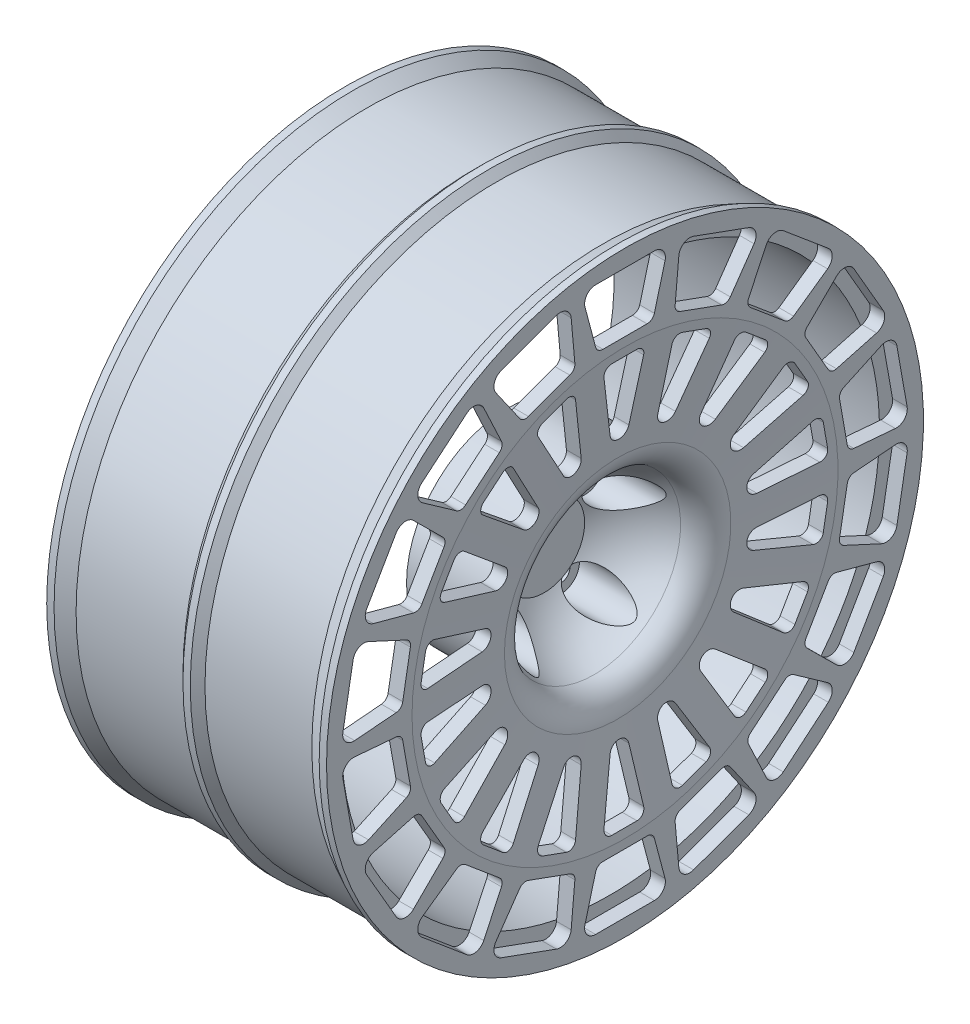
from build123d import *
from OCP.BRepAlgoAPI import BRepAlgoAPI_Cut
from OCP.TopTools import TopTools_ListOfShape

# Parameters (mm, degrees)
CUT_EXTRUDE1_DEPTH       = 345.776347797
CUT_EXTRUDE1_DEPTH_BACK  = 9.973014
CUT_EXTRUDE2_REACH       = 346.776
BOSS_EXTRUDE1_REACH      = 341.368
BOSS_EXTRUDE1_END_RADIUS = 60.077568815
SKETCH9_R                = 27.5
SKETCH10_R               = 27.5
CUT_EXTRUDE3_DEPTH       = 45
SKETCH11_R               = 12.5
CUT_EXTRUDE5_DEPTH       = 60
CUT_EXTRUDE6_REACH       = 313.62
SKETCH12_R               = 6


with BuildPart() as part:
    # Sketch1 → Revolve1 (revolve)
    with BuildSketch(Plane.XY, mode=Mode.PRIVATE) as revolve1_sk:
        with BuildLine():
            Line((-7.5, 198.2), (-80.25, 198.2))
            Line((-80.25, 198.2), (-90.25, 203.2))
            Line((-90.25, 203.2), (-95.25, 203.2))
            Line((-95.25, 203.2), (-95.25, 183.2))
            Line((-95.25, 183.2), (85.276985641, 183.2))
            Line((85.276985641, 183.2), (85.276985641, 145.734155709))
            Line((85.276985641, 145.734155709), (80.276985641, 77.812499305))
            ThreePointArc((80.276985641, 77.812499305), (77.794183907, 71.921195418), (72.25, 68.73783387))
            Line((72.25, 68.73783387), (15.25, 68.73783387))
            Line((15.25, 68.73783387), (15.25, 0))
            Line((15.25, 0), (25.809727319, 0))
            ThreePointArc((25.809727319, 0), (39.456179426, 38.124344925), (74.196028717, 58.929012726))
            ThreePointArc((74.196028717, 58.929012726), (85.284396531, 65.295735823), (90.25, 77.078343596))
            Line((90.25, 77.078343596), (95.25, 145))
            Line((95.25, 145), (95.25, 183.2))
            Line((95.25, 183.2), (95.25, 203.2))
            Line((95.25, 203.2), (90.25, 203.2))
            Line((90.25, 203.2), (80.25, 198.2))
            Line((80.25, 198.2), (7.5, 198.2))
            Line((7.5, 198.2), (2.5, 203.2))
            Line((2.5, 203.2), (-2.5, 203.2))
            Line((-2.5, 203.2), (-7.5, 198.2))
        make_face()
    revolve(revolve1_sk.sketch.rotate(Axis((-95.25, 0, 0), (1, 0, 0)), 90), axis=Axis((-95.25, 0, 0), (1, 0, 0)))


with BuildPart() as cut_extrude1_tool:
    # Sketch2 → Cut-Extrude1 (new, two sides: drawn at the far end of the back side and taken through both)
    with BuildSketch(Plane(origin=(95.25, 0, 0), x_dir=(0, 0, -1), z_dir=(1, 0, 0)).offset(-CUT_EXTRUDE1_DEPTH_BACK)):
        with BuildLine():
            Line((84.289757984, 173.108118749), (46.702053153, 186.788924482))
            ThreePointArc((46.702053153, 186.788924482), (40.115923143, 186.072243048), (36.667281918, 180.415599654))
            Line((36.667281918, 180.415599654), (34.122310629, 152.226365678))
            ThreePointArc((34.122310629, 152.226365678), (34.926689668, 149.026094193), (37.54965233, 147.023887889))
            Line((37.54965233, 147.023887889), (65.740430954, 136.763283589))
            ThreePointArc((65.740430954, 136.763283589), (69.036730331, 136.611054702), (71.710015282, 138.54556001))
            Line((71.710015282, 138.54556001), (87.880144494, 161.775642064))
            ThreePointArc((87.880144494, 161.775642064), (88.874352333, 168.325626153), (84.289757984, 173.108118749))
        make_face()
        with BuildLine():
            Line((8.579866528, 139), (-8.579866528, 139))
            ThreePointArc((-8.579866528, 139), (-12.417217448, 137.205423204), (-13.5, 133.109895167))
            Line((-13.5, 133.109895167), (-6.396173514, 93.842863717))
            ThreePointArc((-6.396173514, 93.842863717), (0, 88.5), (6.396173514, 93.842863717))
            Line((6.396173514, 93.842863717), (13.5, 133.109895167))
            ThreePointArc((13.5, 133.109895167), (12.417217448, 137.205423204), (8.579866528, 139))
        make_face()
        with BuildLine():
            Line((20, 191.497216894), (-20, 191.497216894))
            ThreePointArc((-20, 191.497216894), (-25.943818283, 188.571167508), (-27.249795009, 182.076156686))
            Line((-27.249795009, 182.076156686), (-19.999999905, 154.716510089))
            ThreePointArc((-19.999999905, 154.716510089), (-18.149573546, 151.984352424), (-15, 151))
            Line((-15, 151), (15, 151))
            ThreePointArc((15, 151), (18.149573546, 151.984352424), (19.999999905, 154.716510089))
            Line((19.999999905, 154.716510089), (27.249795009, 182.076156686))
            ThreePointArc((27.249795009, 182.076156686), (25.943818283, 188.571167508), (20, 191.497216894))
        make_face()
        with BuildLine():
            Line((32.840415042, 129.699658177), (26.085712646, 90.37106673))
            ThreePointArc((26.085712646, 90.37106673), (30.268782684, 83.16279694), (38.106586751, 85.995826366))
            Line((38.106586751, 85.995826366), (58.212115804, 120.465114307))
            ThreePointArc((58.212115804, 120.465114307), (58.595386115, 124.683985226), (55.603237186, 127.68278711))
            Line((55.603237186, 127.68278711), (39.478362659, 133.551761469))
            ThreePointArc((39.478362659, 133.551761469), (35.258650903, 133.177862208), (32.840415042, 129.699658177))
        make_face()
        with BuildLine():
            Line((138.412927171, 133.83962668), (107.771149446, 159.551131068))
            ThreePointArc((107.771149446, 159.551131068), (101.337092189, 161.130259942), (96.161743494, 156.994258653))
            Line((96.161743494, 156.994258653), (84.128966909, 131.375474945))
            ThreePointArc((84.128966909, 131.375474945), (83.790278644, 128.093089612), (85.570262416, 125.314525056))
            Line((85.570262416, 125.314525056), (108.551595709, 106.030896766))
            ThreePointArc((108.551595709, 106.030896766), (111.597038564, 104.760447619), (114.770744489, 105.66397068))
            Line((114.770744489, 105.66397068), (137.91085158, 121.962597455))
            ThreePointArc((137.91085158, 121.962597455), (141.085327847, 127.777530062), (138.412927171, 133.83962668))
        make_face()
        with BuildLine():
            Line((75.219791358, 110.645728248), (55.421276877, 75.999185361))
            ThreePointArc((55.421276877, 75.999185361), (56.886703457, 67.794933216), (65.220783232, 67.776423193))
            Line((65.220783232, 67.776423193), (95.902991322, 93.290462786))
            ThreePointArc((95.902991322, 93.290462786), (97.706086442, 97.123818489), (95.920036823, 100.965145697))
            Line((95.920036823, 100.965145697), (82.77491867, 111.99520949))
            ThreePointArc((82.77491867, 111.99520949), (78.681805593, 113.087085533), (75.219791358, 110.645728248))
        make_face()
        with BuildLine():
            Line((175.841454584, 78.428100371), (155.841454584, 113.069116523))
            ThreePointArc((155.841454584, 113.069116523), (150.335512342, 116.753589458), (144.057679609, 114.637093069))
            Line((144.057679609, 114.637093069), (123.988428169, 94.678763038))
            ThreePointArc((123.988428169, 94.678763038), (122.547523404, 91.710167971), (123.269835971, 88.490381057))
            Line((123.269835971, 88.490381057), (138.269835971, 62.509618943))
            ThreePointArc((138.269835971, 62.509618943), (140.69709695, 60.274184453), (143.988428074, 60.037747051))
            Line((143.988428074, 60.037747051), (171.307474618, 67.439063617))
            ThreePointArc((171.307474618, 67.439063617), (176.279330625, 71.81757805), (175.841454584, 78.428100371))
        make_face()
        with BuildLine():
            Line((108.52655071, 78.246290535), (78.072217186, 52.460680609))
            ThreePointArc((78.072217186, 52.460680609), (76.643248235, 44.25), (84.4683907, 41.382183108))
            Line((84.4683907, 41.382183108), (122.02655071, 54.863604632))
            ThreePointArc((122.02655071, 54.863604632), (125.031990756, 57.849085848), (124.66746439, 62.069617626))
            Line((124.66746439, 62.069617626), (116.087597862, 76.930382374))
            ThreePointArc((116.087597862, 76.930382374), (112.614773308, 79.356337356), (108.52655071, 78.246290535))
        make_face()
        with BuildLine():
            Line((192.06090743, 13.556987682), (185.114980324, 52.949297802))
            ThreePointArc((185.114980324, 52.949297802), (181.20125099, 58.294712986), (174.578133498, 58.453002199))
            Line((174.578133498, 58.453002199), (148.893055117, 46.562394999))
            ThreePointArc((148.893055117, 46.562394999), (146.523728232, 44.265646574), (146.10124804, 40.992991123))
            Line((146.10124804, 40.992991123), (151.31069337, 11.448758533))
            ThreePointArc((151.31069337, 11.448758533), (152.827008975, 8.51796509), (155.838982191, 7.170085065))
            Line((155.838982191, 7.170085065), (184.041887988, 4.781383412))
            ThreePointArc((184.041887988, 4.781383412), (190.211444523, 7.195366211), (192.06090743, 13.556987682))
        make_face()
        with BuildLine():
            Line((128.743406365, 36.409195391), (91.306495879, 22.594643538))
            ThreePointArc((91.306495879, 22.594643538), (87.155486142, 15.367863724), (93.527863628, 9.996641005))
            Line((93.527863628, 9.996641005), (133.431907162, 9.81938606))
            ThreePointArc((133.431907162, 9.81938606), (137.277191708, 11.596899692), (138.378155856, 15.68757762))
            Line((138.378155856, 15.68757762), (135.398399482, 32.586615772))
            ThreePointArc((135.398399482, 32.586615772), (132.964737345, 36.054043719), (128.743406365, 36.409195391))
        make_face()
        with BuildLine():
            Line((185.114980324, -52.949297802), (192.06090743, -13.556987682))
            ThreePointArc((192.06090743, -13.556987682), (190.211444523, -7.195366211), (184.041887988, -4.781383412))
            Line((184.041887988, -4.781383412), (155.838982191, -7.170085065))
            ThreePointArc((155.838982191, -7.170085065), (152.827008975, -8.51796509), (151.31069337, -11.448758532))
            Line((151.31069337, -11.448758532), (146.10124804, -40.992991123))
            ThreePointArc((146.10124804, -40.992991123), (146.523728232, -44.265646574), (148.893055118, -46.562394998))
            Line((148.893055118, -46.562394998), (174.578133498, -58.453002198))
            ThreePointArc((174.578133498, -58.453002198), (181.20125099, -58.294712986), (185.114980324, -52.949297802))
        make_face()
        with BuildLine():
            Line((133.431907162, -9.819386059), (93.527863628, -9.996641005))
            ThreePointArc((93.527863628, -9.996641005), (87.155486142, -15.367863723), (91.306495879, -22.594643538))
            Line((91.306495879, -22.594643538), (128.743406365, -36.409195391))
            ThreePointArc((128.743406365, -36.409195391), (132.964737345, -36.054043719), (135.398399482, -32.586615772))
            Line((135.398399482, -32.586615772), (138.378155856, -15.687577619))
            ThreePointArc((138.378155856, -15.687577619), (137.277191708, -11.596899692), (133.431907162, -9.819386059))
        make_face()
        with BuildLine():
            Line((155.841454584, -113.069116522), (175.841454584, -78.428100371))
            ThreePointArc((175.841454584, -78.428100371), (176.279330625, -71.81757805), (171.307474618, -67.439063617))
            Line((171.307474618, -67.439063617), (143.988428074, -60.037747051))
            ThreePointArc((143.988428074, -60.037747051), (140.69709695, -60.274184453), (138.269835972, -62.509618943))
            Line((138.269835972, -62.509618943), (123.269835972, -88.490381057))
            ThreePointArc((123.269835972, -88.490381057), (122.547523404, -91.710167971), (123.988428169, -94.678763038))
            Line((123.988428169, -94.678763038), (144.057679609, -114.637093069))
            ThreePointArc((144.057679609, -114.637093069), (150.335512342, -116.753589458), (155.841454584, -113.069116522))
        make_face()
        with BuildLine():
            Line((122.02655071, -54.863604632), (84.4683907, -41.382183108))
            ThreePointArc((84.4683907, -41.382183108), (76.643248235, -44.25), (78.072217186, -52.460680609))
            Line((78.072217186, -52.460680609), (108.52655071, -78.246290534))
            ThreePointArc((108.52655071, -78.246290534), (112.614773308, -79.356337356), (116.087597862, -76.930382374))
            Line((116.087597862, -76.930382374), (124.66746439, -62.069617626))
            ThreePointArc((124.66746439, -62.069617626), (125.031990756, -57.849085848), (122.02655071, -54.863604632))
        make_face()
        with BuildLine():
            Line((107.771149446, -159.551131068), (138.412927171, -133.83962668))
            ThreePointArc((138.412927171, -133.83962668), (141.085327847, -127.777530062), (137.91085158, -121.962597455))
            Line((137.91085158, -121.962597455), (114.770744489, -105.663970679))
            ThreePointArc((114.770744489, -105.663970679), (111.597038564, -104.760447619), (108.55159571, -106.030896766))
            Line((108.55159571, -106.030896766), (85.570262416, -125.314525056))
            ThreePointArc((85.570262416, -125.314525056), (83.790278644, -128.093089612), (84.128966909, -131.375474945))
            Line((84.128966909, -131.375474945), (96.161743494, -156.994258652))
            ThreePointArc((96.161743494, -156.994258652), (101.33709219, -161.130259942), (107.771149446, -159.551131068))
        make_face()
        with BuildLine():
            Line((95.902991322, -93.290462786), (65.220783233, -67.776423192))
            ThreePointArc((65.220783233, -67.776423192), (56.886703457, -67.794933216), (55.421276877, -75.999185361))
            Line((55.421276877, -75.999185361), (75.219791358, -110.645728247))
            ThreePointArc((75.219791358, -110.645728247), (78.681805593, -113.087085533), (82.77491867, -111.99520949))
            Line((82.77491867, -111.99520949), (95.920036823, -100.965145697))
            ThreePointArc((95.920036823, -100.965145697), (97.706086442, -97.123818489), (95.902991322, -93.290462786))
        make_face()
        with BuildLine():
            Line((46.702053153, -186.788924482), (84.289757984, -173.108118749))
            ThreePointArc((84.289757984, -173.108118749), (88.874352334, -168.325626153), (87.880144494, -161.775642064))
            Line((87.880144494, -161.775642064), (71.710015282, -138.54556001))
            ThreePointArc((71.710015282, -138.54556001), (69.036730331, -136.611054702), (65.740430954, -136.763283589))
            Line((65.740430954, -136.763283589), (37.54965233, -147.023887889))
            ThreePointArc((37.54965233, -147.023887889), (34.926689668, -149.026094193), (34.122310629, -152.226365678))
            Line((34.122310629, -152.226365678), (36.667281918, -180.415599654))
            ThreePointArc((36.667281918, -180.415599654), (40.115923143, -186.072243048), (46.702053153, -186.788924482))
        make_face()
        with BuildLine():
            Line((58.212115804, -120.465114307), (38.106586751, -85.995826366))
            ThreePointArc((38.106586751, -85.995826366), (30.268782684, -83.16279694), (26.085712646, -90.37106673))
            Line((26.085712646, -90.37106673), (32.840415043, -129.699658177))
            ThreePointArc((32.840415043, -129.699658177), (35.258650903, -133.177862208), (39.478362659, -133.551761469))
            Line((39.478362659, -133.551761469), (55.603237186, -127.68278711))
            ThreePointArc((55.603237186, -127.68278711), (58.595386116, -124.683985226), (58.212115804, -120.465114307))
        make_face()
        with BuildLine():
            Line((-20, -191.497216894), (20, -191.497216894))
            ThreePointArc((20, -191.497216894), (25.943818283, -188.571167508), (27.24979501, -182.076156686))
            Line((27.24979501, -182.076156686), (19.999999905, -154.716510089))
            ThreePointArc((19.999999905, -154.716510089), (18.149573546, -151.984352424), (15, -151))
            Line((15, -151), (-15, -151))
            ThreePointArc((-15, -151), (-18.149573546, -151.984352424), (-19.999999905, -154.716510089))
            Line((-19.999999905, -154.716510089), (-27.249795009, -182.076156686))
            ThreePointArc((-27.249795009, -182.076156686), (-25.943818283, -188.571167508), (-20, -191.497216894))
        make_face()
        with BuildLine():
            Line((13.5, -133.109895167), (6.396173514, -93.842863717))
            ThreePointArc((6.396173514, -93.842863717), (0, -88.5), (-6.396173514, -93.842863717))
            Line((-6.396173514, -93.842863717), (-13.5, -133.109895167))
            ThreePointArc((-13.5, -133.109895167), (-12.417217447, -137.205423204), (-8.579866528, -139))
            Line((-8.579866528, -139), (8.579866528, -139))
            ThreePointArc((8.579866528, -139), (12.417217448, -137.205423204), (13.5, -133.109895167))
        make_face()
        with BuildLine():
            Line((-84.289757984, -173.108118749), (-46.702053153, -186.788924482))
            ThreePointArc((-46.702053153, -186.788924482), (-40.115923143, -186.072243048), (-36.667281918, -180.415599654))
            Line((-36.667281918, -180.415599654), (-34.122310629, -152.226365678))
            ThreePointArc((-34.122310629, -152.226365678), (-34.926689668, -149.026094193), (-37.54965233, -147.023887889))
            Line((-37.54965233, -147.023887889), (-65.740430954, -136.763283589))
            ThreePointArc((-65.740430954, -136.763283589), (-69.036730331, -136.611054702), (-71.710015282, -138.54556001))
            Line((-71.710015282, -138.54556001), (-87.880144494, -161.775642064))
            ThreePointArc((-87.880144494, -161.775642064), (-88.874352333, -168.325626153), (-84.289757984, -173.108118749))
        make_face()
        with BuildLine():
            Line((-32.840415042, -129.699658177), (-26.085712646, -90.37106673))
            ThreePointArc((-26.085712646, -90.37106673), (-30.268782684, -83.16279694), (-38.106586751, -85.995826366))
            Line((-38.106586751, -85.995826366), (-58.212115804, -120.465114307))
            ThreePointArc((-58.212115804, -120.465114307), (-58.595386115, -124.683985226), (-55.603237185, -127.68278711))
            Line((-55.603237185, -127.68278711), (-39.478362659, -133.551761469))
            ThreePointArc((-39.478362659, -133.551761469), (-35.258650903, -133.177862208), (-32.840415042, -129.699658177))
        make_face()
        with BuildLine():
            Line((-138.412927171, -133.83962668), (-107.771149446, -159.551131068))
            ThreePointArc((-107.771149446, -159.551131068), (-101.337092189, -161.130259942), (-96.161743494, -156.994258653))
            Line((-96.161743494, -156.994258653), (-84.128966909, -131.375474945))
            ThreePointArc((-84.128966909, -131.375474945), (-83.790278644, -128.093089612), (-85.570262416, -125.314525056))
            Line((-85.570262416, -125.314525056), (-108.551595709, -106.030896766))
            ThreePointArc((-108.551595709, -106.030896766), (-111.597038564, -104.760447619), (-114.770744488, -105.66397068))
            Line((-114.770744488, -105.66397068), (-137.91085158, -121.962597455))
            ThreePointArc((-137.91085158, -121.962597455), (-141.085327847, -127.777530062), (-138.412927171, -133.83962668))
        make_face()
        with BuildLine():
            Line((-75.219791358, -110.645728248), (-55.421276877, -75.999185361))
            ThreePointArc((-55.421276877, -75.999185361), (-56.886703457, -67.794933216), (-65.220783232, -67.776423193))
            Line((-65.220783232, -67.776423193), (-95.902991322, -93.290462786))
            ThreePointArc((-95.902991322, -93.290462786), (-97.706086442, -97.123818489), (-95.920036823, -100.965145697))
            Line((-95.920036823, -100.965145697), (-82.77491867, -111.99520949))
            ThreePointArc((-82.77491867, -111.99520949), (-78.681805593, -113.087085533), (-75.219791358, -110.645728248))
        make_face()
        with BuildLine():
            Line((-175.841454584, -78.428100371), (-155.841454584, -113.069116523))
            ThreePointArc((-155.841454584, -113.069116523), (-150.335512342, -116.753589458), (-144.057679609, -114.637093069))
            Line((-144.057679609, -114.637093069), (-123.988428169, -94.678763038))
            ThreePointArc((-123.988428169, -94.678763038), (-122.547523404, -91.710167971), (-123.269835971, -88.490381057))
            Line((-123.269835971, -88.490381057), (-138.269835971, -62.509618943))
            ThreePointArc((-138.269835971, -62.509618943), (-140.69709695, -60.274184453), (-143.988428074, -60.037747051))
            Line((-143.988428074, -60.037747051), (-171.307474618, -67.439063617))
            ThreePointArc((-171.307474618, -67.439063617), (-176.279330624, -71.81757805), (-175.841454584, -78.428100371))
        make_face()
        with BuildLine():
            Line((-108.52655071, -78.246290535), (-78.072217186, -52.460680609))
            ThreePointArc((-78.072217186, -52.460680609), (-76.643248235, -44.25), (-84.4683907, -41.382183108))
            Line((-84.4683907, -41.382183108), (-122.02655071, -54.863604632))
            ThreePointArc((-122.02655071, -54.863604632), (-125.031990755, -57.849085848), (-124.66746439, -62.069617626))
            Line((-124.66746439, -62.069617626), (-116.087597862, -76.930382374))
            ThreePointArc((-116.087597862, -76.930382374), (-112.614773308, -79.356337356), (-108.52655071, -78.246290535))
        make_face()
        with BuildLine():
            Line((-192.06090743, -13.556987682), (-185.114980324, -52.949297802))
            ThreePointArc((-185.114980324, -52.949297802), (-181.20125099, -58.294712986), (-174.578133498, -58.453002199))
            Line((-174.578133498, -58.453002199), (-148.893055117, -46.562394999))
            ThreePointArc((-148.893055117, -46.562394999), (-146.523728232, -44.265646574), (-146.10124804, -40.992991123))
            Line((-146.10124804, -40.992991123), (-151.31069337, -11.448758533))
            ThreePointArc((-151.31069337, -11.448758533), (-152.827008975, -8.51796509), (-155.838982191, -7.170085065))
            Line((-155.838982191, -7.170085065), (-184.041887988, -4.781383412))
            ThreePointArc((-184.041887988, -4.781383412), (-190.211444523, -7.195366211), (-192.06090743, -13.556987682))
        make_face()
        with BuildLine():
            Line((-128.743406364, -36.409195391), (-91.306495879, -22.594643538))
            ThreePointArc((-91.306495879, -22.594643538), (-87.155486142, -15.367863724), (-93.527863628, -9.996641005))
            Line((-93.527863628, -9.996641005), (-133.431907161, -9.81938606))
            ThreePointArc((-133.431907161, -9.81938606), (-137.277191708, -11.596899692), (-138.378155856, -15.68757762))
            Line((-138.378155856, -15.68757762), (-135.398399481, -32.586615772))
            ThreePointArc((-135.398399481, -32.586615772), (-132.964737345, -36.054043719), (-128.743406364, -36.409195391))
        make_face()
        with BuildLine():
            Line((-185.114980324, 52.949297802), (-192.06090743, 13.556987682))
            ThreePointArc((-192.06090743, 13.556987682), (-190.211444523, 7.195366211), (-184.041887988, 4.781383412))
            Line((-184.041887988, 4.781383412), (-155.838982191, 7.170085065))
            ThreePointArc((-155.838982191, 7.170085065), (-152.827008975, 8.51796509), (-151.31069337, 11.448758532))
            Line((-151.31069337, 11.448758532), (-146.10124804, 40.992991123))
            ThreePointArc((-146.10124804, 40.992991123), (-146.523728232, 44.265646574), (-148.893055117, 46.562394998))
            Line((-148.893055117, 46.562394998), (-174.578133498, 58.453002198))
            ThreePointArc((-174.578133498, 58.453002198), (-181.20125099, 58.294712986), (-185.114980324, 52.949297802))
        make_face()
        with BuildLine():
            Line((-133.431907161, 9.819386059), (-93.527863628, 9.996641005))
            ThreePointArc((-93.527863628, 9.996641005), (-87.155486142, 15.367863723), (-91.306495879, 22.594643538))
            Line((-91.306495879, 22.594643538), (-128.743406364, 36.409195391))
            ThreePointArc((-128.743406364, 36.409195391), (-132.964737345, 36.054043719), (-135.398399482, 32.586615772))
            Line((-135.398399482, 32.586615772), (-138.378155856, 15.687577619))
            ThreePointArc((-138.378155856, 15.687577619), (-137.277191708, 11.596899692), (-133.431907161, 9.819386059))
        make_face()
        with BuildLine():
            Line((-155.841454584, 113.069116522), (-175.841454584, 78.428100371))
            ThreePointArc((-175.841454584, 78.428100371), (-176.279330624, 71.81757805), (-171.307474618, 67.439063617))
            Line((-171.307474618, 67.439063617), (-143.988428074, 60.037747051))
            ThreePointArc((-143.988428074, 60.037747051), (-140.69709695, 60.274184453), (-138.269835971, 62.509618943))
            Line((-138.269835971, 62.509618943), (-123.269835971, 88.490381057))
            ThreePointArc((-123.269835971, 88.490381057), (-122.547523404, 91.710167971), (-123.988428169, 94.678763038))
            Line((-123.988428169, 94.678763038), (-144.057679609, 114.637093069))
            ThreePointArc((-144.057679609, 114.637093069), (-150.335512342, 116.753589458), (-155.841454584, 113.069116522))
        make_face()
        with BuildLine():
            Line((-122.02655071, 54.863604632), (-84.4683907, 41.382183108))
            ThreePointArc((-84.4683907, 41.382183108), (-76.643248235, 44.25), (-78.072217186, 52.460680609))
            Line((-78.072217186, 52.460680609), (-108.52655071, 78.246290534))
            ThreePointArc((-108.52655071, 78.246290534), (-112.614773308, 79.356337356), (-116.087597862, 76.930382374))
            Line((-116.087597862, 76.930382374), (-124.66746439, 62.069617626))
            ThreePointArc((-124.66746439, 62.069617626), (-125.031990755, 57.849085848), (-122.02655071, 54.863604632))
        make_face()
        with BuildLine():
            Line((-107.771149446, 159.551131068), (-138.412927171, 133.83962668))
            ThreePointArc((-138.412927171, 133.83962668), (-141.085327847, 127.777530062), (-137.91085158, 121.962597455))
            Line((-137.91085158, 121.962597455), (-114.770744488, 105.663970679))
            ThreePointArc((-114.770744488, 105.663970679), (-111.597038564, 104.760447619), (-108.551595709, 106.030896766))
            Line((-108.551595709, 106.030896766), (-85.570262416, 125.314525056))
            ThreePointArc((-85.570262416, 125.314525056), (-83.790278644, 128.093089612), (-84.128966909, 131.375474945))
            Line((-84.128966909, 131.375474945), (-96.161743494, 156.994258652))
            ThreePointArc((-96.161743494, 156.994258652), (-101.337092189, 161.130259942), (-107.771149446, 159.551131068))
        make_face()
        with BuildLine():
            Line((-95.902991322, 93.290462786), (-65.220783232, 67.776423192))
            ThreePointArc((-65.220783232, 67.776423192), (-56.886703457, 67.794933216), (-55.421276877, 75.999185361))
            Line((-55.421276877, 75.999185361), (-75.219791358, 110.645728247))
            ThreePointArc((-75.219791358, 110.645728247), (-78.681805593, 113.087085533), (-82.77491867, 111.99520949))
            Line((-82.77491867, 111.99520949), (-95.920036823, 100.965145697))
            ThreePointArc((-95.920036823, 100.965145697), (-97.706086442, 97.123818489), (-95.902991322, 93.290462786))
        make_face()
        with BuildLine():
            Line((-46.702053153, 186.788924482), (-84.289757984, 173.108118749))
            ThreePointArc((-84.289757984, 173.108118749), (-88.874352333, 168.325626153), (-87.880144494, 161.775642064))
            Line((-87.880144494, 161.775642064), (-71.710015282, 138.54556001))
            ThreePointArc((-71.710015282, 138.54556001), (-69.036730331, 136.611054702), (-65.740430954, 136.763283589))
            Line((-65.740430954, 136.763283589), (-37.54965233, 147.023887889))
            ThreePointArc((-37.54965233, 147.023887889), (-34.926689668, 149.026094193), (-34.122310629, 152.226365678))
            Line((-34.122310629, 152.226365678), (-36.667281918, 180.415599654))
            ThreePointArc((-36.667281918, 180.415599654), (-40.115923143, 186.072243048), (-46.702053153, 186.788924482))
        make_face()
        with BuildLine():
            Line((-58.212115804, 120.465114307), (-38.106586751, 85.995826366))
            ThreePointArc((-38.106586751, 85.995826366), (-30.268782684, 83.16279694), (-26.085712646, 90.37106673))
            Line((-26.085712646, 90.37106673), (-32.840415042, 129.699658177))
            ThreePointArc((-32.840415042, 129.699658177), (-35.258650903, 133.177862208), (-39.478362659, 133.551761469))
            Line((-39.478362659, 133.551761469), (-55.603237186, 127.68278711))
            ThreePointArc((-55.603237186, 127.68278711), (-58.595386115, 124.683985226), (-58.212115804, 120.465114307))
        make_face()
    extrude(amount=CUT_EXTRUDE1_DEPTH + CUT_EXTRUDE1_DEPTH_BACK)


with BuildPart() as part_1:
    add(part.part)

    # Cut-Extrude1: cut by cut_extrude1_tool, with a tolerance
    cut_extrude1_stock = TopTools_ListOfShape()
    cut_extrude1_stock.Append(part_1.part.wrapped)
    cut_extrude1_tools = TopTools_ListOfShape()
    cut_extrude1_tools.Append(cut_extrude1_tool.part.wrapped)
    cut_extrude1_cut = BRepAlgoAPI_Cut()
    cut_extrude1_cut.SetArguments(cut_extrude1_stock)
    cut_extrude1_cut.SetTools(cut_extrude1_tools)
    cut_extrude1_cut.SetFuzzyValue(0.00001)
    cut_extrude1_cut.Build()
    add(Compound.cast(cut_extrude1_cut.Shape()).solids(), mode=Mode.REPLACE)

    # Sketch7 → Cut-Extrude2 (cut, up to next)
    with BuildSketch(Plane(origin=(95.25, 0, 0), x_dir=(0, 0, -1), z_dir=(1, 0, 0)), mode=Mode.PRIVATE) as cut_extrude2_sk1:
        with BuildLine():
            Line((13.5, 133.109895167), (6.396173514, 93.842863717))
            ThreePointArc((6.396173514, 93.842863717), (0, 88.5), (-6.396173514, 93.842863717))
            Line((-6.396173514, 93.842863717), (-13.5, 133.109895167))
            ThreePointArc((-13.5, 133.109895167), (-12.417217448, 137.205423204), (-8.579866528, 139))
            Line((-8.579866528, 139), (8.579866528, 139))
            ThreePointArc((8.579866528, 139), (12.417217448, 137.205423204), (13.5, 133.109895167))
        make_face()
    cut_extrude2_tool1 = extrude(cut_extrude2_sk1.sketch, amount=-CUT_EXTRUDE2_REACH, mode=Mode.PRIVATE) & part_1.part
    # Sketch7 → Cut-Extrude2 (cut, up to next)
    with BuildSketch(Plane(origin=(95.25, 0, 0), x_dir=(0, 0, -1), z_dir=(1, 0, 0)), mode=Mode.PRIVATE) as cut_extrude2_sk2:
        with BuildLine():
            Line((58.212115804, 120.465114307), (38.106586751, 85.995826366))
            ThreePointArc((38.106586751, 85.995826366), (30.268782684, 83.16279694), (26.085712646, 90.37106673))
            Line((26.085712646, 90.37106673), (32.840415042, 129.699658177))
            ThreePointArc((32.840415042, 129.699658177), (35.258650903, 133.177862208), (39.478362659, 133.551761469))
            Line((39.478362659, 133.551761469), (55.603237186, 127.68278711))
            ThreePointArc((55.603237186, 127.68278711), (58.595386115, 124.683985226), (58.212115804, 120.465114307))
        make_face()
    cut_extrude2_tool2 = extrude(cut_extrude2_sk2.sketch, amount=-CUT_EXTRUDE2_REACH, mode=Mode.PRIVATE) & part_1.part
    # Sketch7 → Cut-Extrude2 (cut, up to next)
    with BuildSketch(Plane(origin=(95.25, 0, 0), x_dir=(0, 0, -1), z_dir=(1, 0, 0)), mode=Mode.PRIVATE) as cut_extrude2_sk3:
        with BuildLine():
            Line((95.902991322, 93.290462786), (65.220783232, 67.776423192))
            ThreePointArc((65.220783232, 67.776423192), (56.886703457, 67.794933216), (55.421276877, 75.999185361))
            Line((55.421276877, 75.999185361), (75.219791358, 110.645728248))
            ThreePointArc((75.219791358, 110.645728248), (78.681805593, 113.087085533), (82.77491867, 111.99520949))
            Line((82.77491867, 111.99520949), (95.920036823, 100.965145697))
            ThreePointArc((95.920036823, 100.965145697), (97.706086442, 97.123818489), (95.902991322, 93.290462786))
        make_face()
    cut_extrude2_tool3 = extrude(cut_extrude2_sk3.sketch, amount=-CUT_EXTRUDE2_REACH, mode=Mode.PRIVATE) & part_1.part
    # Sketch7 → Cut-Extrude2 (cut, up to next)
    with BuildSketch(Plane(origin=(95.25, 0, 0), x_dir=(0, 0, -1), z_dir=(1, 0, 0)), mode=Mode.PRIVATE) as cut_extrude2_sk4:
        with BuildLine():
            Line((122.02655071, 54.863604632), (84.4683907, 41.382183108))
            ThreePointArc((84.4683907, 41.382183108), (76.643248235, 44.25), (78.072217186, 52.460680609))
            Line((78.072217186, 52.460680609), (108.52655071, 78.246290535))
            ThreePointArc((108.52655071, 78.246290535), (112.614773308, 79.356337356), (116.087597862, 76.930382374))
            Line((116.087597862, 76.930382374), (124.66746439, 62.069617626))
            ThreePointArc((124.66746439, 62.069617626), (125.031990756, 57.849085848), (122.02655071, 54.863604632))
        make_face()
    cut_extrude2_tool4 = extrude(cut_extrude2_sk4.sketch, amount=-CUT_EXTRUDE2_REACH, mode=Mode.PRIVATE) & part_1.part
    # Sketch7 → Cut-Extrude2 (cut, up to next)
    with BuildSketch(Plane(origin=(95.25, 0, 0), x_dir=(0, 0, -1), z_dir=(1, 0, 0)), mode=Mode.PRIVATE) as cut_extrude2_sk5:
        with BuildLine():
            Line((133.431907162, 9.81938606), (93.527863628, 9.996641005))
            ThreePointArc((93.527863628, 9.996641005), (87.155486142, 15.367863724), (91.306495879, 22.594643538))
            Line((91.306495879, 22.594643538), (128.743406364, 36.409195391))
            ThreePointArc((128.743406364, 36.409195391), (132.964737345, 36.054043719), (135.398399482, 32.586615772))
            Line((135.398399482, 32.586615772), (138.378155856, 15.68757762))
            ThreePointArc((138.378155856, 15.68757762), (137.277191708, 11.596899692), (133.431907162, 9.81938606))
        make_face()
    cut_extrude2_tool5 = extrude(cut_extrude2_sk5.sketch, amount=-CUT_EXTRUDE2_REACH, mode=Mode.PRIVATE) & part_1.part
    # Sketch7 → Cut-Extrude2 (cut, up to next)
    with BuildSketch(Plane(origin=(95.25, 0, 0), x_dir=(0, 0, -1), z_dir=(1, 0, 0)), mode=Mode.PRIVATE) as cut_extrude2_sk6:
        with BuildLine():
            Line((128.743406364, -36.409195391), (91.306495879, -22.594643538))
            ThreePointArc((91.306495879, -22.594643538), (87.155486142, -15.367863724), (93.527863628, -9.996641005))
            Line((93.527863628, -9.996641005), (133.431907162, -9.819386059))
            ThreePointArc((133.431907162, -9.819386059), (137.277191708, -11.596899692), (138.378155856, -15.687577619))
            Line((138.378155856, -15.687577619), (135.398399482, -32.586615772))
            ThreePointArc((135.398399482, -32.586615772), (132.964737345, -36.054043719), (128.743406364, -36.409195391))
        make_face()
    cut_extrude2_tool6 = extrude(cut_extrude2_sk6.sketch, amount=-CUT_EXTRUDE2_REACH, mode=Mode.PRIVATE) & part_1.part
    # Sketch7 → Cut-Extrude2 (cut, up to next)
    with BuildSketch(Plane(origin=(95.25, 0, 0), x_dir=(0, 0, -1), z_dir=(1, 0, 0)), mode=Mode.PRIVATE) as cut_extrude2_sk7:
        with BuildLine():
            Line((108.52655071, -78.246290535), (78.072217186, -52.460680609))
            ThreePointArc((78.072217186, -52.460680609), (76.643248235, -44.25), (84.4683907, -41.382183108))
            Line((84.4683907, -41.382183108), (122.02655071, -54.863604632))
            ThreePointArc((122.02655071, -54.863604632), (125.031990756, -57.849085848), (124.66746439, -62.069617626))
            Line((124.66746439, -62.069617626), (116.087597862, -76.930382374))
            ThreePointArc((116.087597862, -76.930382374), (112.614773308, -79.356337356), (108.52655071, -78.246290535))
        make_face()
    cut_extrude2_tool7 = extrude(cut_extrude2_sk7.sketch, amount=-CUT_EXTRUDE2_REACH, mode=Mode.PRIVATE) & part_1.part
    # Sketch7 → Cut-Extrude2 (cut, up to next)
    with BuildSketch(Plane(origin=(95.25, 0, 0), x_dir=(0, 0, -1), z_dir=(1, 0, 0)), mode=Mode.PRIVATE) as cut_extrude2_sk8:
        with BuildLine():
            Line((75.219791358, -110.645728248), (55.421276877, -75.999185361))
            ThreePointArc((55.421276877, -75.999185361), (56.886703457, -67.794933216), (65.220783232, -67.776423192))
            Line((65.220783232, -67.776423192), (95.902991322, -93.290462786))
            ThreePointArc((95.902991322, -93.290462786), (97.706086442, -97.123818489), (95.920036823, -100.965145697))
            Line((95.920036823, -100.965145697), (82.77491867, -111.99520949))
            ThreePointArc((82.77491867, -111.99520949), (78.681805593, -113.087085533), (75.219791358, -110.645728248))
        make_face()
    cut_extrude2_tool8 = extrude(cut_extrude2_sk8.sketch, amount=-CUT_EXTRUDE2_REACH, mode=Mode.PRIVATE) & part_1.part
    # Sketch7 → Cut-Extrude2 (cut, up to next)
    with BuildSketch(Plane(origin=(95.25, 0, 0), x_dir=(0, 0, -1), z_dir=(1, 0, 0)), mode=Mode.PRIVATE) as cut_extrude2_sk9:
        with BuildLine():
            Line((32.840415042, -129.699658177), (26.085712646, -90.37106673))
            ThreePointArc((26.085712646, -90.37106673), (30.268782684, -83.16279694), (38.106586751, -85.995826366))
            Line((38.106586751, -85.995826366), (58.212115804, -120.465114307))
            ThreePointArc((58.212115804, -120.465114307), (58.595386115, -124.683985226), (55.603237186, -127.68278711))
            Line((55.603237186, -127.68278711), (39.478362659, -133.551761469))
            ThreePointArc((39.478362659, -133.551761469), (35.258650903, -133.177862208), (32.840415042, -129.699658177))
        make_face()
    cut_extrude2_tool9 = extrude(cut_extrude2_sk9.sketch, amount=-CUT_EXTRUDE2_REACH, mode=Mode.PRIVATE) & part_1.part
    # Sketch7 → Cut-Extrude2 (cut, up to next)
    with BuildSketch(Plane(origin=(95.25, 0, 0), x_dir=(0, 0, -1), z_dir=(1, 0, 0)), mode=Mode.PRIVATE) as cut_extrude2_sk10:
        with BuildLine():
            Line((-13.5, -133.109895167), (-6.396173514, -93.842863717))
            ThreePointArc((-6.396173514, -93.842863717), (0, -88.5), (6.396173514, -93.842863717))
            Line((6.396173514, -93.842863717), (13.5, -133.109895167))
            ThreePointArc((13.5, -133.109895167), (12.417217448, -137.205423204), (8.579866528, -139))
            Line((8.579866528, -139), (-8.579866528, -139))
            ThreePointArc((-8.579866528, -139), (-12.417217448, -137.205423204), (-13.5, -133.109895167))
        make_face()
    cut_extrude2_tool10 = extrude(cut_extrude2_sk10.sketch, amount=-CUT_EXTRUDE2_REACH, mode=Mode.PRIVATE) & part_1.part
    # Sketch7 → Cut-Extrude2 (cut, up to next)
    with BuildSketch(Plane(origin=(95.25, 0, 0), x_dir=(0, 0, -1), z_dir=(1, 0, 0)), mode=Mode.PRIVATE) as cut_extrude2_sk11:
        with BuildLine():
            Line((-58.212115804, -120.465114307), (-38.106586751, -85.995826366))
            ThreePointArc((-38.106586751, -85.995826366), (-30.268782684, -83.16279694), (-26.085712646, -90.37106673))
            Line((-26.085712646, -90.37106673), (-32.840415042, -129.699658177))
            ThreePointArc((-32.840415042, -129.699658177), (-35.258650903, -133.177862208), (-39.478362659, -133.551761469))
            Line((-39.478362659, -133.551761469), (-55.603237186, -127.68278711))
            ThreePointArc((-55.603237186, -127.68278711), (-58.595386115, -124.683985226), (-58.212115804, -120.465114307))
        make_face()
    cut_extrude2_tool11 = extrude(cut_extrude2_sk11.sketch, amount=-CUT_EXTRUDE2_REACH, mode=Mode.PRIVATE) & part_1.part
    # Sketch7 → Cut-Extrude2 (cut, up to next)
    with BuildSketch(Plane(origin=(95.25, 0, 0), x_dir=(0, 0, -1), z_dir=(1, 0, 0)), mode=Mode.PRIVATE) as cut_extrude2_sk12:
        with BuildLine():
            Line((-95.902991322, -93.290462786), (-65.220783232, -67.776423192))
            ThreePointArc((-65.220783232, -67.776423192), (-56.886703457, -67.794933216), (-55.421276877, -75.999185361))
            Line((-55.421276877, -75.999185361), (-75.219791358, -110.645728248))
            ThreePointArc((-75.219791358, -110.645728248), (-78.681805593, -113.087085533), (-82.77491867, -111.99520949))
            Line((-82.77491867, -111.99520949), (-95.920036823, -100.965145697))
            ThreePointArc((-95.920036823, -100.965145697), (-97.706086442, -97.123818489), (-95.902991322, -93.290462786))
        make_face()
    cut_extrude2_tool12 = extrude(cut_extrude2_sk12.sketch, amount=-CUT_EXTRUDE2_REACH, mode=Mode.PRIVATE) & part_1.part
    # Sketch7 → Cut-Extrude2 (cut, up to next)
    with BuildSketch(Plane(origin=(95.25, 0, 0), x_dir=(0, 0, -1), z_dir=(1, 0, 0)), mode=Mode.PRIVATE) as cut_extrude2_sk13:
        with BuildLine():
            Line((-122.02655071, -54.863604632), (-84.4683907, -41.382183108))
            ThreePointArc((-84.4683907, -41.382183108), (-76.643248235, -44.25), (-78.072217186, -52.460680609))
            Line((-78.072217186, -52.460680609), (-108.52655071, -78.246290535))
            ThreePointArc((-108.52655071, -78.246290535), (-112.614773308, -79.356337356), (-116.087597862, -76.930382374))
            Line((-116.087597862, -76.930382374), (-124.66746439, -62.069617626))
            ThreePointArc((-124.66746439, -62.069617626), (-125.031990755, -57.849085848), (-122.02655071, -54.863604632))
        make_face()
    cut_extrude2_tool13 = extrude(cut_extrude2_sk13.sketch, amount=-CUT_EXTRUDE2_REACH, mode=Mode.PRIVATE) & part_1.part
    # Sketch7 → Cut-Extrude2 (cut, up to next)
    with BuildSketch(Plane(origin=(95.25, 0, 0), x_dir=(0, 0, -1), z_dir=(1, 0, 0)), mode=Mode.PRIVATE) as cut_extrude2_sk14:
        with BuildLine():
            Line((-133.431907161, -9.81938606), (-93.527863628, -9.996641005))
            ThreePointArc((-93.527863628, -9.996641005), (-87.155486142, -15.367863724), (-91.306495879, -22.594643538))
            Line((-91.306495879, -22.594643538), (-128.743406364, -36.409195391))
            ThreePointArc((-128.743406364, -36.409195391), (-132.964737345, -36.054043719), (-135.398399482, -32.586615772))
            Line((-135.398399482, -32.586615772), (-138.378155856, -15.68757762))
            ThreePointArc((-138.378155856, -15.68757762), (-137.277191708, -11.596899692), (-133.431907161, -9.81938606))
        make_face()
    cut_extrude2_tool14 = extrude(cut_extrude2_sk14.sketch, amount=-CUT_EXTRUDE2_REACH, mode=Mode.PRIVATE) & part_1.part
    # Sketch7 → Cut-Extrude2 (cut, up to next)
    with BuildSketch(Plane(origin=(95.25, 0, 0), x_dir=(0, 0, -1), z_dir=(1, 0, 0)), mode=Mode.PRIVATE) as cut_extrude2_sk15:
        with BuildLine():
            Line((-128.743406364, 36.409195391), (-91.306495879, 22.594643538))
            ThreePointArc((-91.306495879, 22.594643538), (-87.155486142, 15.367863724), (-93.527863628, 9.996641005))
            Line((-93.527863628, 9.996641005), (-133.431907162, 9.81938606))
            ThreePointArc((-133.431907162, 9.81938606), (-137.277191708, 11.596899692), (-138.378155856, 15.687577619))
            Line((-138.378155856, 15.687577619), (-135.398399482, 32.586615772))
            ThreePointArc((-135.398399482, 32.586615772), (-132.964737345, 36.054043719), (-128.743406364, 36.409195391))
        make_face()
    cut_extrude2_tool15 = extrude(cut_extrude2_sk15.sketch, amount=-CUT_EXTRUDE2_REACH, mode=Mode.PRIVATE) & part_1.part
    # Sketch7 → Cut-Extrude2 (cut, up to next)
    with BuildSketch(Plane(origin=(95.25, 0, 0), x_dir=(0, 0, -1), z_dir=(1, 0, 0)), mode=Mode.PRIVATE) as cut_extrude2_sk16:
        with BuildLine():
            Line((-108.52655071, 78.246290535), (-78.072217186, 52.460680609))
            ThreePointArc((-78.072217186, 52.460680609), (-76.643248235, 44.25), (-84.4683907, 41.382183108))
            Line((-84.4683907, 41.382183108), (-122.02655071, 54.863604632))
            ThreePointArc((-122.02655071, 54.863604632), (-125.031990756, 57.849085848), (-124.66746439, 62.069617626))
            Line((-124.66746439, 62.069617626), (-116.087597862, 76.930382374))
            ThreePointArc((-116.087597862, 76.930382374), (-112.614773308, 79.356337356), (-108.52655071, 78.246290535))
        make_face()
    cut_extrude2_tool16 = extrude(cut_extrude2_sk16.sketch, amount=-CUT_EXTRUDE2_REACH, mode=Mode.PRIVATE) & part_1.part
    # Sketch7 → Cut-Extrude2 (cut, up to next)
    with BuildSketch(Plane(origin=(95.25, 0, 0), x_dir=(0, 0, -1), z_dir=(1, 0, 0)), mode=Mode.PRIVATE) as cut_extrude2_sk17:
        with BuildLine():
            Line((-75.219791358, 110.645728248), (-55.421276877, 75.999185361))
            ThreePointArc((-55.421276877, 75.999185361), (-56.886703457, 67.794933216), (-65.220783232, 67.776423192))
            Line((-65.220783232, 67.776423192), (-95.902991322, 93.290462786))
            ThreePointArc((-95.902991322, 93.290462786), (-97.706086442, 97.123818489), (-95.920036823, 100.965145697))
            Line((-95.920036823, 100.965145697), (-82.77491867, 111.99520949))
            ThreePointArc((-82.77491867, 111.99520949), (-78.681805593, 113.087085533), (-75.219791358, 110.645728248))
        make_face()
    cut_extrude2_tool17 = extrude(cut_extrude2_sk17.sketch, amount=-CUT_EXTRUDE2_REACH, mode=Mode.PRIVATE) & part_1.part
    # Sketch7 → Cut-Extrude2 (cut, up to next)
    with BuildSketch(Plane(origin=(95.25, 0, 0), x_dir=(0, 0, -1), z_dir=(1, 0, 0)), mode=Mode.PRIVATE) as cut_extrude2_sk18:
        with BuildLine():
            Line((-32.840415042, 129.699658177), (-26.085712646, 90.37106673))
            ThreePointArc((-26.085712646, 90.37106673), (-30.268782684, 83.16279694), (-38.106586751, 85.995826366))
            Line((-38.106586751, 85.995826366), (-58.212115804, 120.465114307))
            ThreePointArc((-58.212115804, 120.465114307), (-58.595386115, 124.683985226), (-55.603237186, 127.68278711))
            Line((-55.603237186, 127.68278711), (-39.478362659, 133.551761469))
            ThreePointArc((-39.478362659, 133.551761469), (-35.258650903, 133.177862208), (-32.840415042, 129.699658177))
        make_face()
    cut_extrude2_tool18 = extrude(cut_extrude2_sk18.sketch, amount=-CUT_EXTRUDE2_REACH, mode=Mode.PRIVATE) & part_1.part
    add(cut_extrude2_tool1.solids().sort_by_distance((95.25, 117.601722, 0))[0], mode=Mode.SUBTRACT)
    add(cut_extrude2_tool2.solids().sort_by_distance((95.25, 110.50947, -40.222158))[0], mode=Mode.SUBTRACT)
    add(cut_extrude2_tool3.solids().sort_by_distance((95.25, 90.088145, -75.592929))[0], mode=Mode.SUBTRACT)
    add(cut_extrude2_tool4.solids().sort_by_distance((95.25, 58.800861, -101.846078))[0], mode=Mode.SUBTRACT)
    add(cut_extrude2_tool5.solids().sort_by_distance((95.25, 20.421325, -115.815087))[0], mode=Mode.SUBTRACT)
    add(cut_extrude2_tool6.solids().sort_by_distance((95.25, -20.421325, -115.815087))[0], mode=Mode.SUBTRACT)
    add(cut_extrude2_tool7.solids().sort_by_distance((95.25, -58.800861, -101.846078))[0], mode=Mode.SUBTRACT)
    add(cut_extrude2_tool8.solids().sort_by_distance((95.25, -90.088145, -75.592929))[0], mode=Mode.SUBTRACT)
    add(cut_extrude2_tool9.solids().sort_by_distance((95.25, -110.50947, -40.222158))[0], mode=Mode.SUBTRACT)
    add(cut_extrude2_tool10.solids().sort_by_distance((95.25, -117.601722, 0))[0], mode=Mode.SUBTRACT)
    add(cut_extrude2_tool11.solids().sort_by_distance((95.25, -110.50947, 40.222158))[0], mode=Mode.SUBTRACT)
    add(cut_extrude2_tool12.solids().sort_by_distance((95.25, -90.088145, 75.592929))[0], mode=Mode.SUBTRACT)
    add(cut_extrude2_tool13.solids().sort_by_distance((95.25, -58.800861, 101.846078))[0], mode=Mode.SUBTRACT)
    add(cut_extrude2_tool14.solids().sort_by_distance((95.25, -20.421325, 115.815087))[0], mode=Mode.SUBTRACT)
    add(cut_extrude2_tool15.solids().sort_by_distance((95.25, 20.421325, 115.815087))[0], mode=Mode.SUBTRACT)
    add(cut_extrude2_tool16.solids().sort_by_distance((95.25, 58.800861, 101.846078))[0], mode=Mode.SUBTRACT)
    add(cut_extrude2_tool17.solids().sort_by_distance((95.25, 90.088145, 75.592929))[0], mode=Mode.SUBTRACT)
    add(cut_extrude2_tool18.solids().sort_by_distance((95.25, 110.50947, 40.222158))[0], mode=Mode.SUBTRACT)

    # Boss-Extrude1: up to this sphere (the profile starts inside it)
    boss_extrude1_end = Location((85.887296133, 0, 0)) * Sphere(BOSS_EXTRUDE1_END_RADIUS, mode=Mode.PRIVATE)
    # Sketch9 → Boss-Extrude1 (add, up to the surface)
    with BuildSketch(Plane(origin=(85.276985641, 0, 0), x_dir=(0, 0, -1), z_dir=(1, 0, 0)), mode=Mode.PRIVATE) as boss_extrude1_sk1:
        Circle(SKETCH9_R)
    boss_extrude1_tool1 = extrude(boss_extrude1_sk1.sketch, amount=-BOSS_EXTRUDE1_REACH, mode=Mode.PRIVATE) & boss_extrude1_end
    add(boss_extrude1_tool1.solids().sort_by_distance((85.276986, 0, 0))[0])

    # Sketch10 → Cut-Extrude3 (cut)
    with BuildSketch(Plane(origin=(85.276985641, 0, 0), x_dir=(0, 0, -1), z_dir=(1, 0, 0))):
        Circle(SKETCH10_R)
    extrude(amount=-CUT_EXTRUDE3_DEPTH, mode=Mode.SUBTRACT)

    # Sketch11 → Cut-Extrude5 (cut)
    with BuildSketch(Plane(origin=(85.276985641, 0, 0), x_dir=(0, 0, -1), z_dir=(1, 0, 0))):
        with Locations((0, 45)):
            Circle(SKETCH11_R)
        with Locations((42.797543233, 13.905764747)):
            Circle(SKETCH11_R)
        with Locations((26.450336353, -36.405764747)):
            Circle(SKETCH11_R)
        with Locations((-26.450336353, -36.405764747)):
            Circle(SKETCH11_R)
        with Locations((-42.797543233, 13.905764747)):
            Circle(SKETCH11_R)
    extrude(amount=-CUT_EXTRUDE5_DEPTH, mode=Mode.SUBTRACT)

    # Sketch12 → Cut-Extrude6 (cut, up to next)
    with BuildSketch(Plane(origin=(25.276985641, 0, 0), x_dir=(0, 0, -1), z_dir=(1, 0, 0)), mode=Mode.PRIVATE) as cut_extrude6_sk1:
        with Locations((0, 45)):
            Circle(SKETCH12_R)
    cut_extrude6_tool1 = extrude(cut_extrude6_sk1.sketch, amount=-CUT_EXTRUDE6_REACH, mode=Mode.PRIVATE) & part_1.part
    # Sketch12 → Cut-Extrude6 (cut, up to next)
    with BuildSketch(Plane(origin=(25.276985641, 0, 0), x_dir=(0, 0, -1), z_dir=(1, 0, 0)), mode=Mode.PRIVATE) as cut_extrude6_sk2:
        with Locations((42.797543233, 13.905764747)):
            Circle(SKETCH12_R)
    cut_extrude6_tool2 = extrude(cut_extrude6_sk2.sketch, amount=-CUT_EXTRUDE6_REACH, mode=Mode.PRIVATE) & part_1.part
    # Sketch12 → Cut-Extrude6 (cut, up to next)
    with BuildSketch(Plane(origin=(25.276985641, 0, 0), x_dir=(0, 0, -1), z_dir=(1, 0, 0)), mode=Mode.PRIVATE) as cut_extrude6_sk3:
        with Locations((26.450336353, -36.405764747)):
            Circle(SKETCH12_R)
    cut_extrude6_tool3 = extrude(cut_extrude6_sk3.sketch, amount=-CUT_EXTRUDE6_REACH, mode=Mode.PRIVATE) & part_1.part
    # Sketch12 → Cut-Extrude6 (cut, up to next)
    with BuildSketch(Plane(origin=(25.276985641, 0, 0), x_dir=(0, 0, -1), z_dir=(1, 0, 0)), mode=Mode.PRIVATE) as cut_extrude6_sk4:
        with Locations((-26.450336353, -36.405764747)):
            Circle(SKETCH12_R)
    cut_extrude6_tool4 = extrude(cut_extrude6_sk4.sketch, amount=-CUT_EXTRUDE6_REACH, mode=Mode.PRIVATE) & part_1.part
    # Sketch12 → Cut-Extrude6 (cut, up to next)
    with BuildSketch(Plane(origin=(25.276985641, 0, 0), x_dir=(0, 0, -1), z_dir=(1, 0, 0)), mode=Mode.PRIVATE) as cut_extrude6_sk5:
        with Locations((-42.797543233, 13.905764747)):
            Circle(SKETCH12_R)
    cut_extrude6_tool5 = extrude(cut_extrude6_sk5.sketch, amount=-CUT_EXTRUDE6_REACH, mode=Mode.PRIVATE) & part_1.part
    add(cut_extrude6_tool1.solids().sort_by_distance((25.276986, 45, 0))[0], mode=Mode.SUBTRACT)
    add(cut_extrude6_tool2.solids().sort_by_distance((25.276986, 13.905765, -42.797543))[0], mode=Mode.SUBTRACT)
    add(cut_extrude6_tool3.solids().sort_by_distance((25.276986, -36.405765, -26.450336))[0], mode=Mode.SUBTRACT)
    add(cut_extrude6_tool4.solids().sort_by_distance((25.276986, -36.405765, 26.450336))[0], mode=Mode.SUBTRACT)
    add(cut_extrude6_tool5.solids().sort_by_distance((25.276986, 13.905765, 42.797543))[0], mode=Mode.SUBTRACT)


solid = part_1.part
